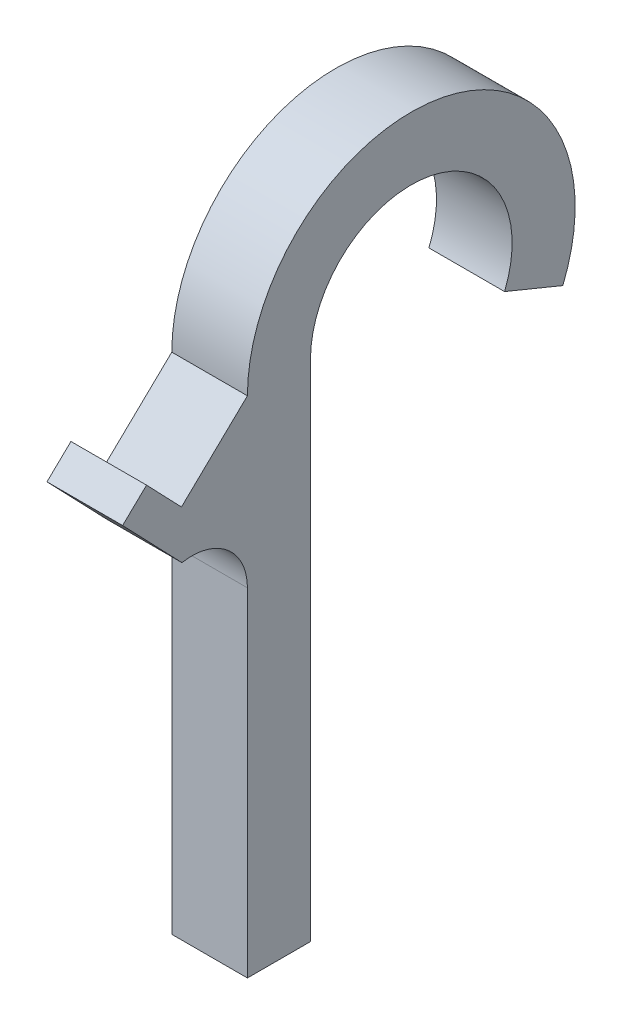
from build123d import *

# Parameters (mm, degrees)
BOSS_EXTRUDE1_DEPTH = 3.81
FILLET1_R           = 2.794


with BuildPart() as part:
    # Sketch1 → Boss-Extrude1 (new body)
    with BuildSketch(Plane(origin=(0, 0, 0), x_dir=(0, 0, -1), z_dir=(1, 0, 0))):
        with BuildLine():
            Line((-5.08, 0), (-5.08, -25.4))
            Line((-5.08, -25.4), (-8.255, -25.4))
            Line((-8.255, -25.4), (-8.255, -2.463960679))
            Line((-8.255, -2.463960679), (-11.554166285, -5.629191448))
            Line((-11.554166285, -5.629191448), (-14.543550901, -2.513312179))
            Line((-14.543550901, -2.513312179), (-13.336585788, -1.355345959))
            Line((-13.336585788, -1.355345959), (-11.57812425, -3.188216118))
            Line((-11.57812425, -3.188216118), (-8.255, 0))
            ThreePointArc((-8.255, 0), (1.598457615, 8.098762761), (7.635965052, -3.136409209))
            Line((7.635965052, -3.136409209), (4.699055417, -1.930097975))
            ThreePointArc((4.699055417, -1.930097975), (0.983666225, 4.983854007), (-5.08, 0))
        make_face()
    extrude(amount=BOSS_EXTRUDE1_DEPTH)

    # Fillet1
    # the kernel refuses this fillet: 2.794 mm, written as the material it adds along each edge
    with BuildSketch(Plane(origin=(0, -2.463960679, 8.255), x_dir=(0, -1, 0), z_dir=(1, 0, 0))) as fillet1_piece_1:
        with BuildLine():
            CenterArc((5.913183284, -2.794), FILLET1_R, 90, 100.416592131)
            Line((3.165230769, -3.299166285), (3.110271719, -3.309269611))
            ThreePointArc((3.110271719, -3.309269611), (1.542292241, -1.688269296), (-0.040323143, -0.038686154))
            Line((-0.040323143, -0.038686154), (0, 0.05588))
            Line((0, 0.05588), (5.913183284, 0.05588))
            Line((5.913183284, 0.05588), (5.913183284, 0))
        make_face()
    extrude(amount=3.81)


solid = part.part
